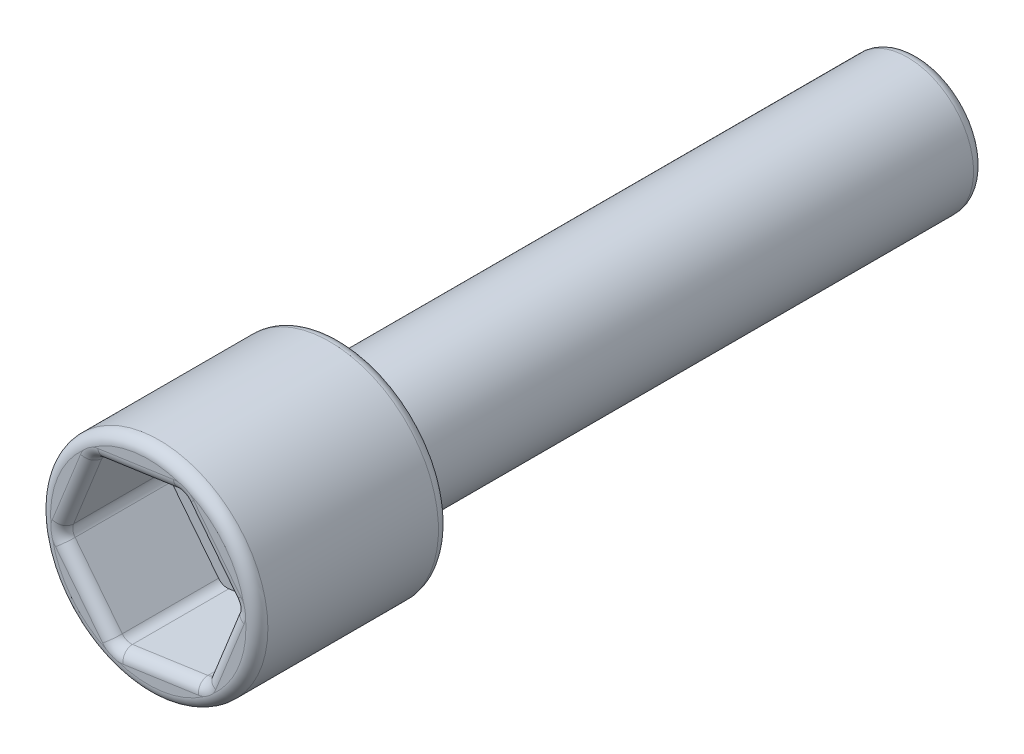
from build123d import *

# Parameters (mm, degrees)
SKETCH1_R           = 5.0165
BOSS_EXTRUDE1_DEPTH = 5.08
BOSS_EXTRUDE2_START = 3.81
SKETCH3_R           = 5.0165
BOSS_EXTRUDE2_DEPTH = 3.81
SKETCH5_R           = 3.048
BOSS_EXTRUDE3_DEPTH = 26.67
SKETCH6_R           = 1.651
CUT_EXTRUDE3_DEPTH  = 37.260779701
CUT_EXTRUDE4_DEPTH  = 4.953
FILLET1_R           = 0.508


with BuildPart() as part:
    # Sketch1 → Boss-Extrude1 (new body)
    with BuildSketch(Plane.XY):
        Circle(SKETCH1_R)
    extrude(amount=BOSS_EXTRUDE1_DEPTH)

    # Sketch3 → Boss-Extrude2 (add)
    with BuildSketch(Plane(origin=(0, 0, 0), x_dir=(-1, 0, 0), z_dir=(0, 0, -1)).offset(BOSS_EXTRUDE2_START)):
        Circle(SKETCH3_R)
    extrude(amount=-BOSS_EXTRUDE2_DEPTH)

    # Sketch5 → Boss-Extrude3 (add)
    with BuildSketch(Plane(origin=(0, 0, -3.81), x_dir=(-1, 0, 0), z_dir=(0, 0, -1))):
        Circle(SKETCH5_R)
    extrude(amount=BOSS_EXTRUDE3_DEPTH)

    # Sketch6 → Cut-Extrude3 (cut, through all)
    with BuildSketch(Plane(origin=(0, 0, -30.48), x_dir=(-1, 0, 0), z_dir=(0, 0, -1))):
        Circle(SKETCH6_R)
    extrude(amount=-CUT_EXTRUDE3_DEPTH, mode=Mode.SUBTRACT)

    # Sketch8 → Cut-Extrude4 (cut)
    with BuildSketch(Plane.XY.offset(5.08)):
        Polygon((1.524, 3.812821178), (-2.54, 3.226233304), (-4.064, -0.586587873), (-1.524, -3.812821178), (2.54, -3.226233304), (4.064, 0.586587873), align=None)
    extrude(amount=-CUT_EXTRUDE4_DEPTH, mode=Mode.SUBTRACT)

    # Fillet1
    # the kernel refuses this fillet: 0.508 mm, written as the material it adds along each edge
    with BuildSketch(Plane(origin=(1.524, 3.812821178, 5.08), x_dir=(-0.9897433186107871, -0.14285714285714157, 0), z_dir=(0, 0, -1))) as fillet1_piece_1:
        with BuildLine():
            CenterArc((FILLET1_R * 0.57735026919, -FILLET1_R), FILLET1_R, 90, 60)
            Line((-FILLET1_R * 0.288675134595, -FILLET1_R * 0.5), (0, 0))
            Line((0, 0), (FILLET1_R * 0.57735026919, 0))
        make_face()
    extrude(amount=5.686234842)
    with BuildSketch(Plane(origin=(4.064, 0.586587873, 5.08), x_dir=(-0.37115374447904703, -0.9285714285714277, 0), z_dir=(0, 0, -1)), Plane(origin=(2.54, -3.226233304, 5.08), x_dir=(-0.9897433186107876, -0.14285714285713977, 0), z_dir=(0, 0, -1)), Plane(origin=(-1.524, -3.812821178, 5.08), x_dir=(-0.6185895741317401, 0.7857142857142871, 0), z_dir=(0, 0, -1)), Plane(origin=(-4.064, -0.586587873, 5.08), x_dir=(0.3711537444790479, 0.9285714285714274, 0), z_dir=(0, 0, -1)), Plane(origin=(-2.54, 3.226233304, 5.08), x_dir=(0.9897433186107873, 0.14285714285714018, 0), z_dir=(0, 0, -1))) as fillet1_piece_2:
        with BuildLine():
            CenterArc((FILLET1_R * 0.57735026919, FILLET1_R), FILLET1_R, 210, 60)
            Line((-FILLET1_R * 0.288675134595, FILLET1_R * 0.5), (0, 0))
            Line((0, 0), (FILLET1_R * 0.57735026919, 0))
        make_face()
    extrude(amount=5.686234842)
    with BuildSketch(Plane(origin=(0, 0, -3.81), x_dir=(-1, 0, 0), z_dir=(0, -1, 0))) as fillet1_piece_3:
        with BuildLine():
            CenterArc((3.048 + FILLET1_R, FILLET1_R), FILLET1_R, 180, 90)
            Line((3.048, FILLET1_R), (3.048, 0))
            Line((3.048, 0), (3.048 + FILLET1_R, 0))
        make_face()
    revolve(axis=Axis((0, 0, -3.81), (0, 0, -1)))
    # the kernel refuses this fillet: 0.508 mm, written as the material it takes off along each edge
    with BuildSketch(Plane(origin=(0, 0, -30.48), x_dir=(-1, 0, 0), z_dir=(0, -1, 0))) as fillet1_2_piece_1:
        with BuildLine():
            CenterArc((1.651 + FILLET1_R, -FILLET1_R), FILLET1_R, 90, 90)
            Line((1.651 + FILLET1_R, 0), (1.651, 0))
            Line((1.651, 0), (1.651, -FILLET1_R))
        make_face()
    revolve(axis=Axis((0, 0, -30.48), (0, 0, -1)), mode=Mode.SUBTRACT)
    with BuildSketch(Plane(origin=(0, 0, 0.127), x_dir=(-1, 0, 0), z_dir=(0, -1, 0))) as fillet1_2_piece_2:
        with BuildLine():
            CenterArc((1.651 + FILLET1_R, FILLET1_R), FILLET1_R, 180, 90)
            Line((1.651, FILLET1_R), (1.651, 0))
            Line((1.651, 0), (1.651 + FILLET1_R, 0))
        make_face()
    revolve(axis=Axis((0, 0, 0.127), (0, 0, -1)), mode=Mode.SUBTRACT)
    with BuildSketch(Plane(origin=(0, 0, 5.08), x_dir=(1, 0, 0), z_dir=(0, -1, 0))) as fillet1_2_piece_3:
        with BuildLine():
            CenterArc((5.0165 - FILLET1_R, -FILLET1_R), FILLET1_R, 0, 90)
            Line((5.0165 - FILLET1_R, 0), (5.0165, 0))
            Line((5.0165, 0), (5.0165, -FILLET1_R))
        make_face()
    revolve(axis=Axis((0, 0, 5.08), (0, 0, 1)), mode=Mode.SUBTRACT)
    with BuildSketch(Plane(origin=(0, 0, -3.81), x_dir=(-1, 0, 0), z_dir=(0, -1, 0))) as fillet1_2_piece_4:
        with BuildLine():
            CenterArc((5.0165 - FILLET1_R, -FILLET1_R), FILLET1_R, 0, 90)
            Line((5.0165 - FILLET1_R, 0), (5.0165, 0))
            Line((5.0165, 0), (5.0165, -FILLET1_R))
        make_face()
    revolve(axis=Axis((0, 0, -3.81), (0, 0, -1)), mode=Mode.SUBTRACT)
    with BuildSketch(Plane(origin=(0, 0, -30.48), x_dir=(-1, 0, 0), z_dir=(0, -1, 0))) as fillet1_2_piece_5:
        with BuildLine():
            CenterArc((3.048 - FILLET1_R, -FILLET1_R), FILLET1_R, 0, 90)
            Line((3.048 - FILLET1_R, 0), (3.048, 0))
            Line((3.048, 0), (3.048, -FILLET1_R))
        make_face()
    revolve(axis=Axis((0, 0, -30.48), (0, 0, -1)), mode=Mode.SUBTRACT)
    # the kernel refuses this fillet: 0.508 mm, written as the material it takes off along each edge
    with BuildSketch(Plane(origin=(3.882571429, 0.81703311, 5.08), x_dir=(0.785714285714287, 0.6185895741317401, 0), z_dir=(-0.6185895741317402, 0.785714285714287, 0)), Plane(origin=(1.233714286, 3.770922044, 5.08), x_dir=(-0.14285714285714085, 0.9897433186107873, 0), z_dir=(-0.9897433186107873, -0.14285714285714085, 0)), Plane(origin=(-2.648857143, 2.953888934, 5.08), x_dir=(-0.9285714285714276, 0.3711537444790474, 0), z_dir=(-0.3711537444790474, -0.9285714285714277, 0)), Plane(origin=(-3.882571429, -0.81703311, 5.08), x_dir=(-0.7857142857142873, -0.6185895741317399, 0), z_dir=(0.6185895741317399, -0.7857142857142874, 0)), Plane(origin=(-1.233714286, -3.770922044, 5.08), x_dir=(0.14285714285714043, -0.9897433186107873, 0), z_dir=(0.9897433186107875, 0.14285714285714043, 0)), Plane(origin=(2.648857143, -2.953888934, 5.08), x_dir=(0.9285714285714277, -0.3711537444790472, 0), z_dir=(0.3711537444790472, 0.9285714285714277, 0))) as fillet1_3_piece_1:
        with BuildLine():
            CenterArc((FILLET1_R, FILLET1_R), FILLET1_R, 180, 90)
            Line((0, FILLET1_R), (0, 0))
            Line((0, 0), (FILLET1_R, 0))
        make_face()
    extrude(amount=3.519527241, mode=Mode.SUBTRACT)
    with BuildSketch(Plane(origin=(2.177142857, -2.765342832, 5.08), x_dir=(0.1428571428571401, -0.9897433186107875, 0), z_dir=(-0.9897433186107875, -0.1428571428571401, 0))) as fillet1_3_piece_2:
        with BuildLine():
            CenterArc((0.508 + FILLET1_R, -FILLET1_R), FILLET1_R, 90, 90)
            Line((0.508, -FILLET1_R), (0.508, 0))
            Line((0.508, 0), (0.508 + FILLET1_R, 0))
        make_face()
    revolve(axis=Axis((2.177142857, -2.765342832, 5.08), (0, 0, 1)), revolution_arc=60, mode=Mode.SUBTRACT)
    with BuildSketch(Plane(origin=(3.483428571, 0.502789606, 5.08), x_dir=(0.928571428571428, -0.3711537444790467, 0), z_dir=(-0.3711537444790467, -0.928571428571428, 0))) as fillet1_3_piece_3:
        with BuildLine():
            CenterArc((0.508 + FILLET1_R, -FILLET1_R), FILLET1_R, 90, 90)
            Line((0.508, -FILLET1_R), (0.508, 0))
            Line((0.508, 0), (0.508 + FILLET1_R, 0))
        make_face()
    revolve(axis=Axis((3.483428571, 0.502789606, 5.08), (0, 0, 1)), revolution_arc=60, mode=Mode.SUBTRACT)
    with BuildSketch(Plane(origin=(-1.306285714, -3.268132438, 5.08), x_dir=(-0.7857142857142874, -0.6185895741317398, 0), z_dir=(-0.6185895741317398, 0.7857142857142874, 0))) as fillet1_3_piece_4:
        with BuildLine():
            CenterArc((0.508 + FILLET1_R, -FILLET1_R), FILLET1_R, 90, 90)
            Line((0.508, -FILLET1_R), (0.508, 0))
            Line((0.508, 0), (0.508 + FILLET1_R, 0))
        make_face()
    revolve(axis=Axis((-1.306285714, -3.268132438, 5.08), (0, 0, 1)), revolution_arc=60, mode=Mode.SUBTRACT)
    with BuildSketch(Plane(origin=(-3.483428571, -0.502789606, 5.08), x_dir=(-0.9285714285714278, 0.371153744479047, 0), z_dir=(0.371153744479047, 0.9285714285714278, 0))) as fillet1_3_piece_5:
        with BuildLine():
            CenterArc((0.508 + FILLET1_R, -FILLET1_R), FILLET1_R, 90, 90)
            Line((0.508, -FILLET1_R), (0.508, 0))
            Line((0.508, 0), (0.508 + FILLET1_R, 0))
        make_face()
    revolve(axis=Axis((-3.483428571, -0.502789606, 5.08), (0, 0, 1)), revolution_arc=60, mode=Mode.SUBTRACT)
    with BuildSketch(Plane(origin=(-2.177142857, 2.765342832, 5.08), x_dir=(-0.14285714285714096, 0.9897433186107872, 0), z_dir=(0.9897433186107872, 0.14285714285714096, 0))) as fillet1_3_piece_6:
        with BuildLine():
            CenterArc((0.508 + FILLET1_R, -FILLET1_R), FILLET1_R, 90, 90)
            Line((0.508, -FILLET1_R), (0.508, 0))
            Line((0.508, 0), (0.508 + FILLET1_R, 0))
        make_face()
    revolve(axis=Axis((-2.177142857, 2.765342832, 5.08), (0, 0, 1)), revolution_arc=60, mode=Mode.SUBTRACT)
    with BuildSketch(Plane(origin=(1.306285714, 3.268132438, 5.08), x_dir=(-0.14285714285714096, 0.9897433186107872, 0), z_dir=(-0.9897433186107872, -0.14285714285714096, 0))) as fillet1_3_piece_7:
        with BuildLine():
            CenterArc((0.508 + FILLET1_R, FILLET1_R), FILLET1_R, 180, 90)
            Line((0.508, FILLET1_R), (0.508, 0))
            Line((0.508, 0), (0.508 + FILLET1_R, 0))
        make_face()
    revolve(axis=Axis((1.306285714, 3.268132438, 5.08), (0, 0, -1)), revolution_arc=60, mode=Mode.SUBTRACT)


solid = part.part
